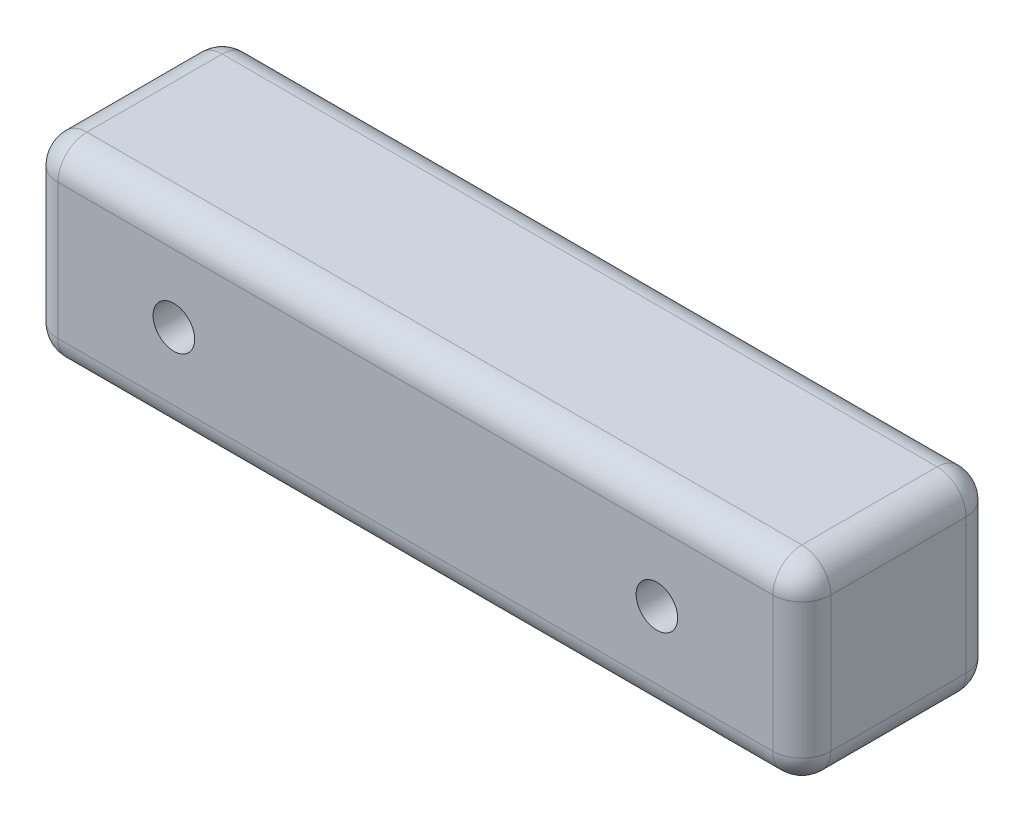
from build123d import *

# Parameters (mm, degrees)
CROQUIS1_W              = 80
CROQUIS1_H              = 20
CROQUIS1_R              = 2.15
SALIENTE_EXTRUIR1_DEPTH = 20
REDONDEO1_R             = 3


with BuildPart() as part:
    # Croquis1 → Saliente-Extruir1 (new body)
    with BuildSketch(Plane.XY):
        Rectangle(CROQUIS1_W, CROQUIS1_H)
        with Locations((25, 0)):
            Circle(CROQUIS1_R, mode=Mode.SUBTRACT)
        with Locations((-25, 0)):
            Circle(CROQUIS1_R, mode=Mode.SUBTRACT)
    extrude(amount=SALIENTE_EXTRUIR1_DEPTH)

    # Redondeo1
    redondeo1_edges = [part.edges().sort_by_distance(p)[0] for p in [
        (0, -10, 20),
        (-40, -10, 10),
        (-40, 0, 20),
        (0, 10, 20),
        (40, 0, 20),
        (40, -10, 10),
        (0, -10, 0),
        (-40, 0, 0),
        (-40, 10, 10),
        (40, 10, 10),
        (40, 0, 0),
        (0, 10, 0),
    ]]
    fillet(redondeo1_edges, radius=REDONDEO1_R)


solid = part.part
